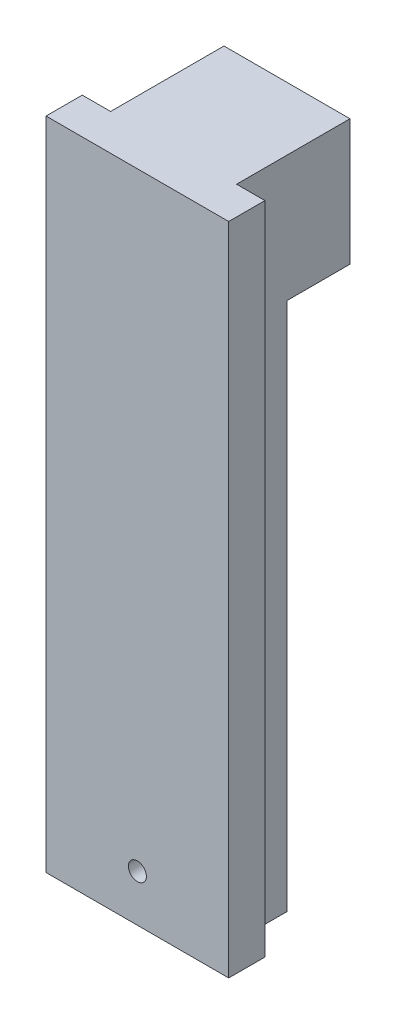
from build123d import *

# Parameters (mm, degrees)
DODANIE_WYCI_GNI_CIE1_DEPTH = 104
SZKIC2_W                    = 20
SZKIC2_H                    = 20
DODANIE_WYCI_GNI_CIE2_DEPTH = 10
SZKIC3_R                    = 2.5
WYTNIJ_WYCI_GNI_CIE1_DEPTH  = 10
SZKIC4_R                    = 1.425
WYTNIJ_WYCI_GNI_CIE2_DEPTH  = 108.658313659


with BuildPart() as part:
    # Szkic1 → Dodanie-wyciągnięcie1 (new body)
    with BuildSketch(Plane(origin=(0, 0, 0), x_dir=(1, 0, 0), z_dir=(0, 1, 0))):
        Polygon((-14.5, 0), (14.5, 0), (14.5, 5.75), (10, 5.75), (10, 13.75), (-10, 13.75), (-10, 5.75), (-14.5, 5.75), align=None)
    extrude(amount=DODANIE_WYCI_GNI_CIE1_DEPTH)

    # Szkic2 → Dodanie-wyciągnięcie2 (add)
    with BuildSketch(Plane(origin=(0, 0, -13.75), x_dir=(-1, 0, 0), z_dir=(0, 0, -1))):
        with Locations((0, 94)):
            Rectangle(SZKIC2_W, SZKIC2_H)
    extrude(amount=DODANIE_WYCI_GNI_CIE2_DEPTH)

    # Szkic3 → Wytnij-wyciągnięcie1 (cut)
    with BuildSketch(Plane(origin=(0, 0, -23.75), x_dir=(-1, 0, 0), z_dir=(0, 0, -1))):
        with Locations((0, 94)):
            Circle(SZKIC3_R)
    extrude(amount=-WYTNIJ_WYCI_GNI_CIE1_DEPTH, mode=Mode.SUBTRACT)

    # Szkic4 → Wytnij-wyciągnięcie2 (cut, through all)
    with BuildSketch(Plane.XY):
        with Locations((0, 7.425)):
            Circle(SZKIC4_R)
    extrude(amount=-WYTNIJ_WYCI_GNI_CIE2_DEPTH, mode=Mode.SUBTRACT)


solid = part.part
